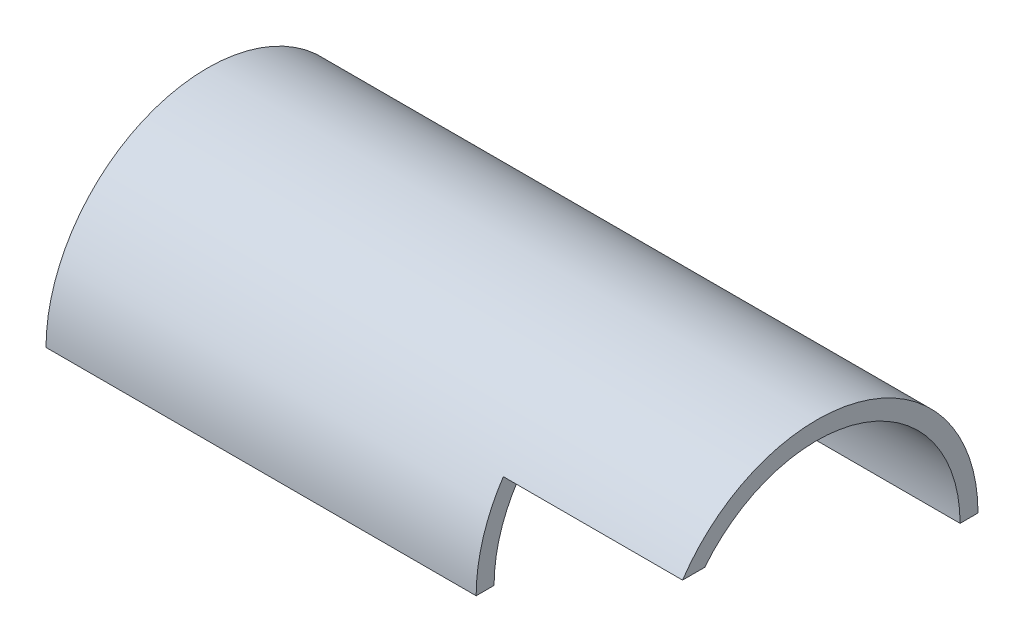
from build123d import *

# Parameters (mm, degrees)
BOSS_EXTRUDE1_DEPTH = 107.95
SKETCH2_W           = 31.75
SKETCH2_H           = 15.875
CUT_EXTRUDE1_DEPTH  = 127
CUT_EXTRUDE2_START  = -107.95
CUT_EXTRUDE2_DEPTH  = 107.95


# Read off the part's stored shape, not the designer's step: Cut-Extrude2
with BuildPart() as part:
    # Sketch1 → Boss-Extrude1 (new body)
    with BuildSketch(Plane(origin=(0, 0, 0), x_dir=(0, 0, -1), z_dir=(1, 0, 0))):
        with BuildLine():
            Line((-31.75, 0), (-25.4, 0))
            ThreePointArc((-25.4, 0), (0, 25.4), (25.4, 0))
            Line((25.4, 0), (31.75, 0))
            ThreePointArc((31.75, 0), (0, 31.75), (-31.75, 0))
        make_face()
    extrude(amount=-BOSS_EXTRUDE1_DEPTH)

    # Sketch2 → Cut-Extrude1 (cut)
    with BuildSketch(Plane.XY):
        with Locations((-15.875, 7.9375)):
            Rectangle(SKETCH2_W, SKETCH2_H)
    extrude(amount=CUT_EXTRUDE1_DEPTH, mode=Mode.SUBTRACT)

    # Cut-Extrude2 outline → Cut-Extrude2 (cut)
    with BuildSketch(Plane.ZY.offset(107.95).offset(CUT_EXTRUDE2_START)):
        with BuildLine():
            Line((28.575, 0), (31.75, 0))
            ThreePointArc((31.75, 0), (0, 31.75), (-31.75, 0))
            Line((-31.75, 0), (-28.575, 0))
            ThreePointArc((-28.575, 0), (0, 28.575), (28.575, 0))
        make_face()
    extrude(amount=CUT_EXTRUDE2_DEPTH, mode=Mode.SUBTRACT)


solid = part.part
